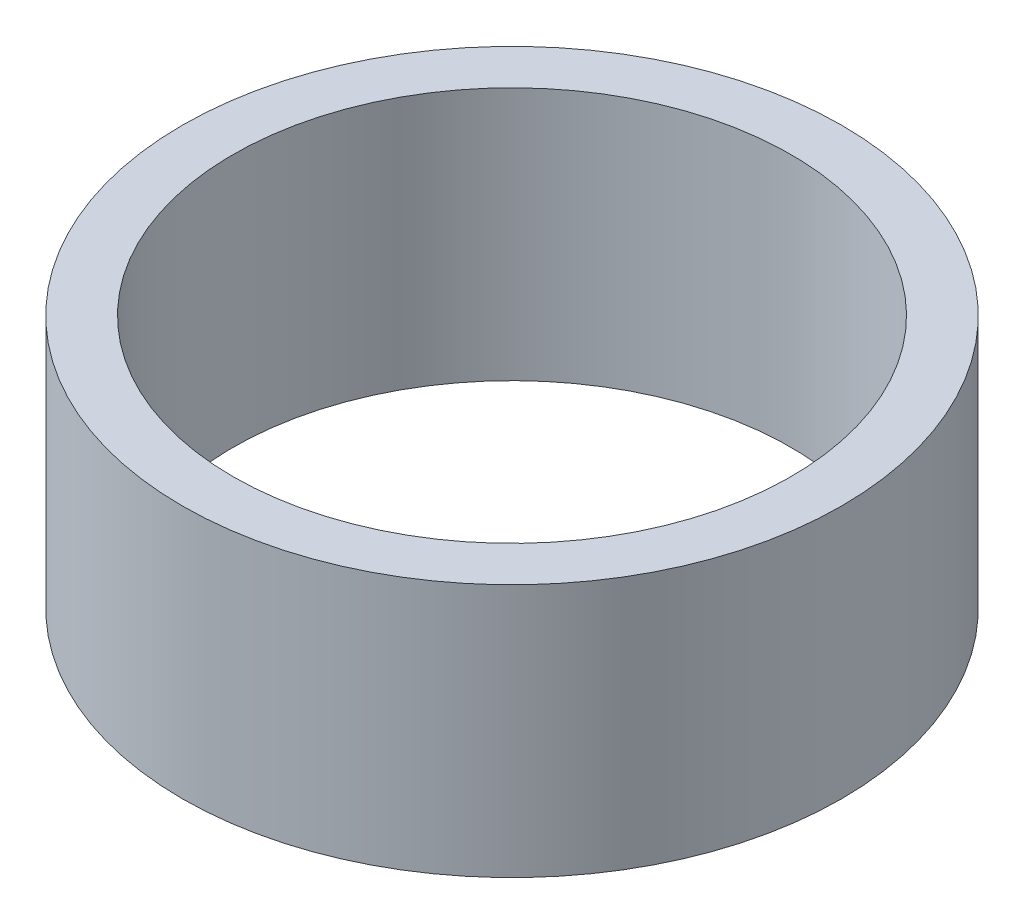
from build123d import *

# Parameters (mm, degrees)
SKETCH1_R           = 65
SKETCH1_R_2         = 55
BOSS_EXTRUDE1_DEPTH = 50


with BuildPart() as part:
    # Sketch1 → Boss-Extrude1 (new body)
    with BuildSketch(Plane(origin=(0, 0, 0), x_dir=(1, 0, 0), z_dir=(0, 1, 0))):
        Circle(SKETCH1_R)
        Circle(SKETCH1_R_2, mode=Mode.SUBTRACT)
    extrude(amount=BOSS_EXTRUDE1_DEPTH)


solid = part.part
